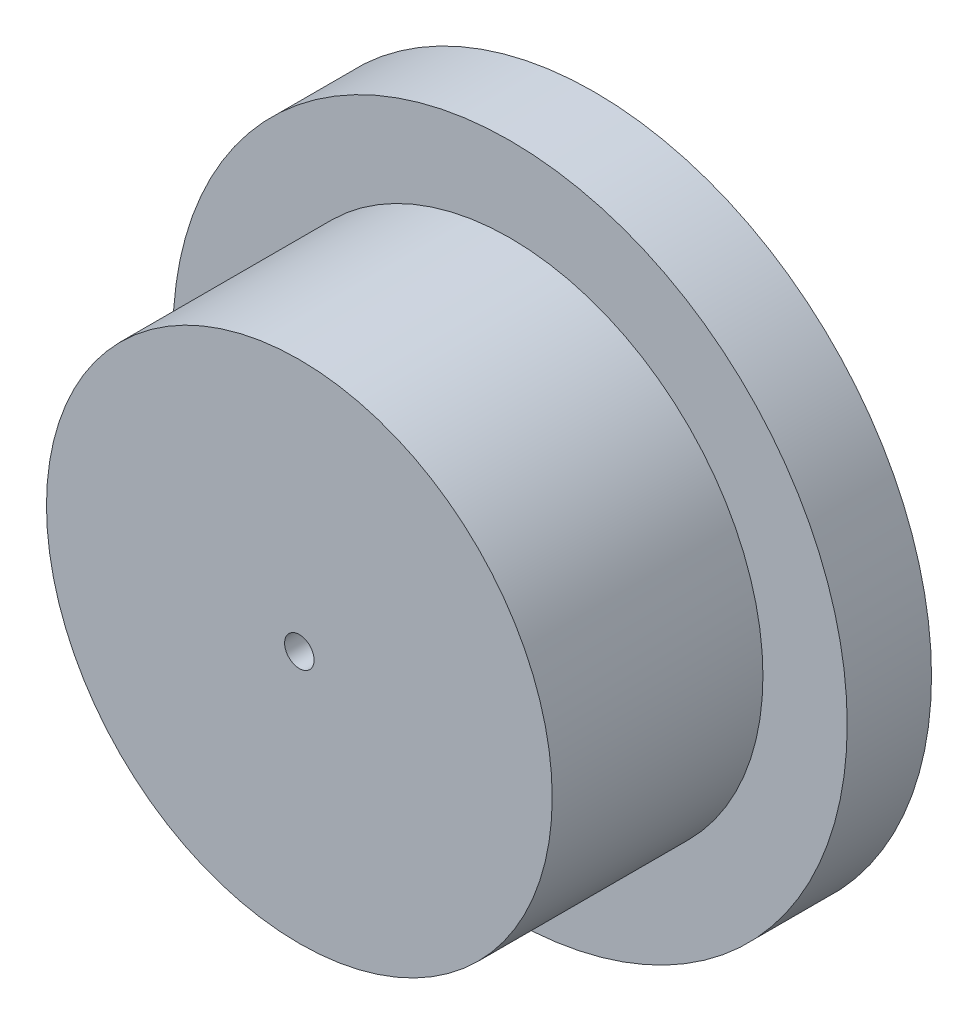
from build123d import *

# Parameters (mm, degrees)
SKETCH1_R           = 8
BOSS_EXTRUDE1_DEPTH = 2
SKETCH2_R           = 6
BOSS_EXTRUDE2_DEPTH = 5
SKETCH3_R           = 2
CUT_EXTRUDE1_DEPTH  = 2
SKETCH4_R           = 0.35
CUT_EXTRUDE2_DEPTH  = 14.304134696
CHAMFER2_SIZE       = 2


with BuildPart() as part:
    # Sketch1 → Boss-Extrude1 (new body)
    with BuildSketch(Plane.XY):
        Circle(SKETCH1_R)
    extrude(amount=BOSS_EXTRUDE1_DEPTH)

    # Sketch2 → Boss-Extrude2 (add)
    with BuildSketch(Plane.XY.offset(2)):
        Circle(SKETCH2_R)
    extrude(amount=BOSS_EXTRUDE2_DEPTH)

    # Sketch3 → Cut-Extrude1 (cut)
    with BuildSketch(Plane(origin=(0, 0, 0), x_dir=(-1, 0, 0), z_dir=(0, 0, -1))):
        Circle(SKETCH3_R)
    extrude(amount=-CUT_EXTRUDE1_DEPTH, mode=Mode.SUBTRACT)

    # Sketch4 → Cut-Extrude2 (cut, through all)
    with BuildSketch(Plane.XY.offset(7)):
        Circle(SKETCH4_R)
    extrude(amount=-CUT_EXTRUDE2_DEPTH, mode=Mode.SUBTRACT)

    # Chamfer2
    # the kernel refuses this chamfer: 2 mm, written as the material it takes off along each edge
    with BuildSketch(Plane(origin=(0, 0, 2), x_dir=(1, 0, 0), z_dir=(0, -1, 0))) as chamfer2_piece_1_section:
        Polygon((0.35 + CHAMFER2_SIZE, 0), (0.35, CHAMFER2_SIZE), (0.35, 0), align=None)
    chamfer2_piece_1 = revolve(axis=Axis((0, 0, 2), (0, 0, 1)), mode=Mode.PRIVATE)
    chamfer2_piece_1 = chamfer2_piece_1 & Plane(origin=(0, 0, 3.186782056), x_dir=(-1, 0, 0), z_dir=(0, 0, -1)) * Cylinder(2, 10, mode=Mode.PRIVATE)
    add(chamfer2_piece_1, mode=Mode.SUBTRACT)


solid = part.part
